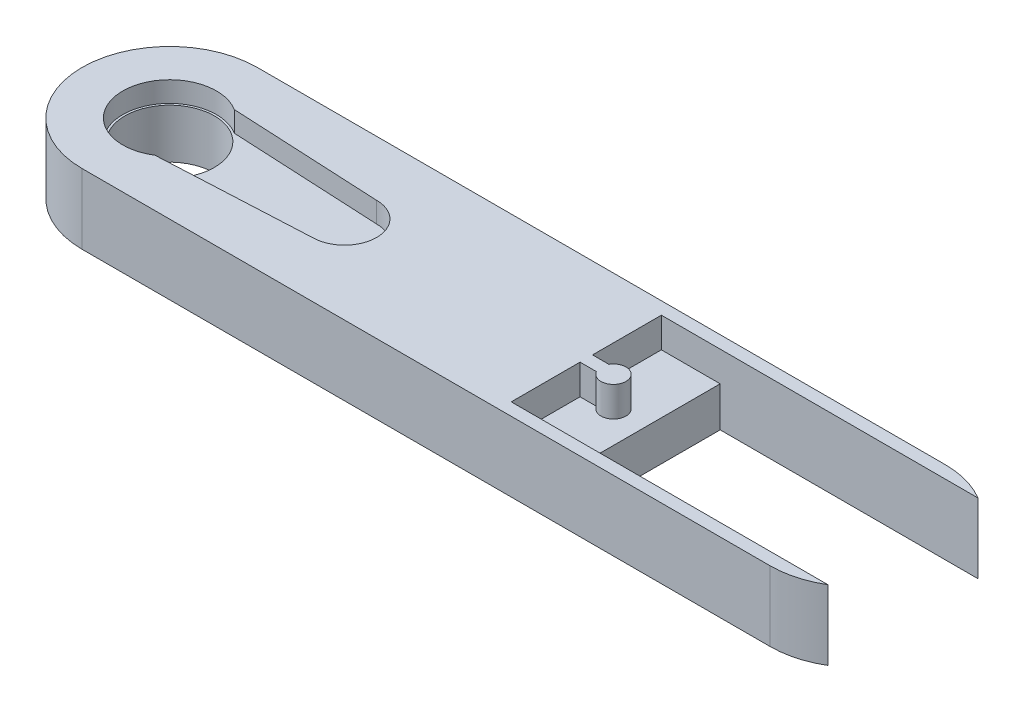
from build123d import *

# Parameters (mm, degrees)
BOSS_EXTRUDE1_DEPTH = 3.95
SKETCH2_R           = 3.575
CUT_EXTRUDE1_DEPTH  = 3.95
BOSS_EXTRUDE2_DEPTH = 1.64
SKETCH4_R           = 3.25
CUT_EXTRUDE2_DEPTH  = 63.643819328
CAVITY1_OUTLINE_R   = 3.25
CAVITY1_DEPTH       = 5.59
CAVITY1_START       = 3.19
CAVITY1_2_DEPTH     = 2.4
CUT_EXTRUDE4_DEPTH  = 63.643819328


# Read off the part's stored shape, not the designer's step: Cavity1
with BuildPart() as part:
    # Sketch1 → Boss-Extrude1 (new body)
    with BuildSketch(Plane(origin=(0, 0, 0), x_dir=(1, 0, 0), z_dir=(0, 1, 0))):
        with BuildLine():
            Line((0, 7), (55, 7))
            ThreePointArc((55, 7), (62, 0), (55, -7))
            Line((55, -7), (0, -7))
            ThreePointArc((0, -7), (-7, 0), (0, 7))
        make_face()
    extrude(amount=BOSS_EXTRUDE1_DEPTH)

    # Sketch2 → Cut-Extrude1 (cut)
    with BuildSketch(Plane.XZ):
        with Locations(Location((0, 0, 0), (0, 0, 270))):
            Circle(SKETCH2_R)
    extrude(amount=-CUT_EXTRUDE1_DEPTH, mode=Mode.SUBTRACT)

    # Sketch3 → Boss-Extrude2 (add)
    with BuildSketch(Plane(origin=(0, 3.95, 0), x_dir=(1, 0, 0), z_dir=(0, 1, 0))):
        with BuildLine():
            Line((0, -7), (55, -7))
            ThreePointArc((55, -7), (62, 0), (55, 7))
            Line((55, 7), (0, 7))
            ThreePointArc((0, 7), (-7, 0), (0, -7))
        make_face()
        with BuildLine():
            Line((13.979308982, 2.569996388), (1.997926282, 3.167540934))
            ThreePointArc((1.997926282, 3.167540934), (-3.745, 0), (1.997926282, -3.167540934))
            Line((1.997926282, -3.167540934), (13.979308982, -2.569996388))
            ThreePointArc((13.979308982, -2.569996388), (16.545, 0), (13.979308982, 2.569996388))
        make_face(mode=Mode.SUBTRACT)
    extrude(amount=BOSS_EXTRUDE2_DEPTH)

    # Sketch4 → Cut-Extrude2 (cut, through all)
    with BuildSketch(Plane(origin=(0, 5.59, 0), x_dir=(1, 0, 0), z_dir=(0, 1, 0))):
        with Locations(Location((55, 0, 0), (0, 0, 270))):
            Circle(SKETCH4_R)
    extrude(amount=-CUT_EXTRUDE2_DEPTH, mode=Mode.SUBTRACT)

    # Cavity1 outline → Cavity1 (cut)
    with BuildSketch(Plane(origin=(0, 0, 0), x_dir=(1, 0, 0), z_dir=(0, 1, 0))):
        with BuildLine():
            Line((58.605551275, 6), (38, 6))
            Line((38, 6), (38, -6))
            Line((38, -6), (58.605551275, -6))
            ThreePointArc((58.605551275, -6), (59.949747468, -4.949747468), (61, -3.605551275))
            Line((61, -3.605551275), (61, 3.605551275))
            ThreePointArc((61, 3.605551275), (59.949747468, 4.949747468), (58.605551275, 6))
        make_face()
        with Locations((55, 0)):
            Circle(CAVITY1_OUTLINE_R, mode=Mode.SUBTRACT)
    extrude(amount=CAVITY1_DEPTH, mode=Mode.SUBTRACT)

    # Cavity1 2 outline → Cavity1 2 (cut)
    with BuildSketch(Plane(origin=(0, 0, 0), x_dir=(1, 0, 0), z_dir=(0, 1, 0)).offset(CAVITY1_START)):
        with BuildLine():
            Line((33.3, 0.5), (34.605619966, 0.5))
            ThreePointArc((34.605619966, 0.5), (36.47164537, 0), (34.605619966, -0.5))
            Line((34.605619966, -0.5), (33.3, -0.5))
            Line((33.3, -0.5), (33.3, -6))
            Line((33.3, -6), (38, -6))
            Line((38, -6), (38, 6))
            Line((38, 6), (33.3, 6))
            Line((33.3, 6), (33.3, 0.5))
        make_face()
        with BuildLine():
            ThreePointArc((61, -3.605551275), (62, 0), (61, 3.605551275))
            Line((61, 3.605551275), (61, -3.605551275))
        make_face()
    extrude(amount=CAVITY1_2_DEPTH, mode=Mode.SUBTRACT)

    # Sketch5 → Cut-Extrude4 (cut, through all)
    with BuildSketch(Plane.XZ):
        with BuildLine():
            Line((61, 3.605551275), (61, -3.605551275))
            ThreePointArc((61, -3.605551275), (62, 0), (61, 3.605551275))
        make_face()
    extrude(amount=-CUT_EXTRUDE4_DEPTH, mode=Mode.SUBTRACT)


solid = part.part
